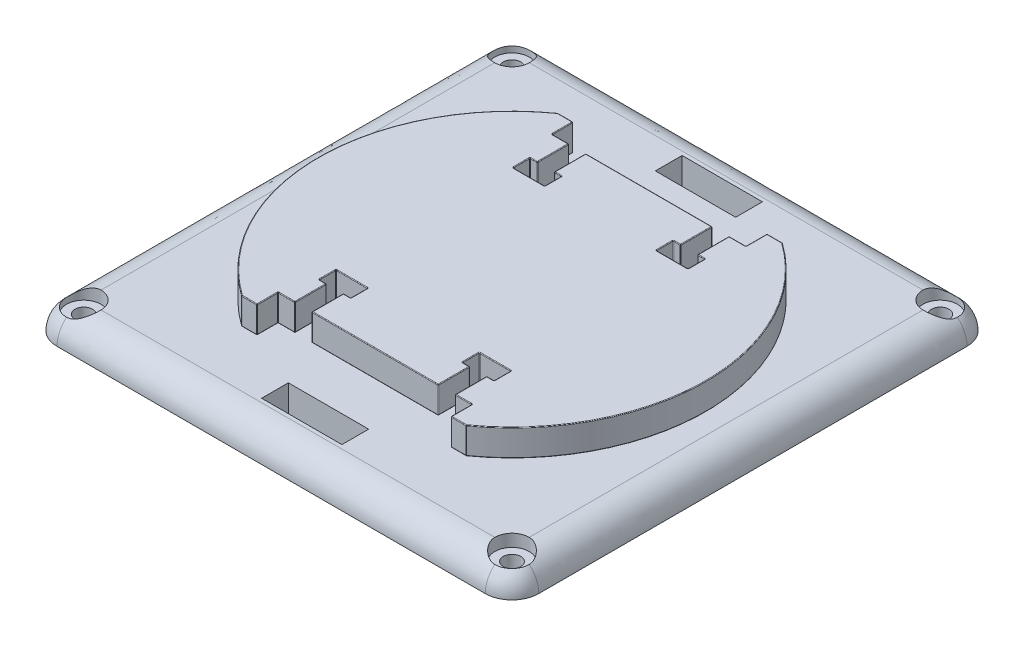
from build123d import *

# Parameters (mm, degrees)
BOSS_EXTRUDE1_DEPTH = 6.35
SKETCH2_W           = 4
SKETCH2_H           = 7.5
SKETCH2_W_2         = 7.5
SKETCH2_H_2         = 4
CUT_EXTRUDE1_DEPTH  = 60.687289267
FILLET1_R           = 0.15
SKETCH3_W           = 114.3
SKETCH3_H           = 114.3
BOSS_EXTRUDE2_DEPTH = 6.35
FILLET4_R           = 6.35
FILLET5_R           = 6.35
FILLET6_R           = 6.35
FILLET7_R           = 6.35
SKETCH4_R           = 4.0894
SKETCH4_R_2         = 2.0828
CUT_EXTRUDE3_DEPTH  = 2.921
SKETCH5_R           = 2.0828
CUT_EXTRUDE4_DEPTH  = 82.071373025
SKETCH6_W           = 19.05
SKETCH6_H           = 6.35
CUT_EXTRUDE5_DEPTH  = 82.071373025


with BuildPart() as part:
    # Sketch1 → Boss-Extrude1 (new body)
    with BuildSketch(Plane(origin=(0, 0, 0), x_dir=(1, 0, 0), z_dir=(0, 1, 0))):
        with BuildLine():
            Line((-26.64113361, 37.5), (-23, 37.5))
            Line((-23, 37.5), (-23, 32.5))
            Line((-23, 32.5), (23, 32.5))
            Line((23, 32.5), (23, 37.5))
            Line((23, 37.5), (26.64113361, 37.5))
            ThreePointArc((26.64113361, 37.5), (46, 0), (26.64113361, -37.5))
            Line((26.64113361, -37.5), (23, -37.5))
            Line((23, -37.5), (23, -32.5))
            Line((23, -32.5), (-23, -32.5))
            Line((-23, -32.5), (-23, -37.5))
            Line((-23, -37.5), (-26.64113361, -37.5))
            ThreePointArc((-26.64113361, -37.5), (-46, 0), (-26.64113361, 37.5))
        make_face()
    extrude(amount=BOSS_EXTRUDE1_DEPTH)

    # Sketch2 → Cut-Extrude1 (cut, through all)
    with BuildSketch(Plane(origin=(0, 6.35, 0), x_dir=(1, 0, 0), z_dir=(0, 1, 0))):
        with Locations((-17, 28.75)):
            Rectangle(SKETCH2_W, SKETCH2_H)
        with Locations((-17, 23)):
            Rectangle(SKETCH2_W_2, SKETCH2_H_2)
        with Locations((17, 23)):
            Rectangle(SKETCH2_W_2, SKETCH2_H_2)
        with Locations((17, 28.75)):
            Rectangle(SKETCH2_W, SKETCH2_H)
        with Locations((17, -28.75)):
            Rectangle(SKETCH2_W, SKETCH2_H)
        with Locations((17, -23)):
            Rectangle(SKETCH2_W_2, SKETCH2_H_2)
        with Locations((-17, -23)):
            Rectangle(SKETCH2_W_2, SKETCH2_H_2)
        with Locations((-17, -28.75)):
            Rectangle(SKETCH2_W, SKETCH2_H)
    extrude(amount=-CUT_EXTRUDE1_DEPTH, mode=Mode.SUBTRACT)

    # Fillet1
    fillet1_edges = [part.edges().sort_by_distance(p)[0] for p in [
        (15, 6.35, -28.75),
        (15, 3.175, -25),
        (15, 3.175, -32.5),
        (19, 0, -28.75),
        (19, 3.175, -32.5),
        (19.875, 0, -25),
        (13.25, 0, -23),
        (14.125, 0, -25),
        (15, 0, -28.75),
        (17, 6.35, -21),
        (20.75, 6.35, -23),
        (19, 6.35, -28.75),
        (17, 0, -21),
        (20.75, 3.175, -21),
        (13.25, 6.35, -23),
        (13.25, 3.175, -21),
        (20.75, 0, -23),
        (20.75, 3.175, -25),
        (19, 3.175, -25),
        (19.875, 6.35, -25),
        (13.25, 3.175, -25),
        (14.125, 6.35, -25),
        (-21, 0, 32.5),
        (-23, 0, 35),
        (46, 6.35, 0),
        (-24.820566805, 0, 37.5),
        (-46, 0, 0),
        (-24.820566805, 0, -37.5),
        (-23, 0, -35),
        (21, 0, -32.5),
        (23, 0, -35),
        (24.820566805, 0, -37.5),
        (46, 0, 0),
        (24.820566805, 0, 37.5),
        (23, 0, 35),
        (24.820566805, 6.35, -37.5),
        (23, 3.175, 32.5),
        (-23, 3.175, 32.5),
        (-23, 3.175, 37.5),
        (23, 6.35, -35),
        (-26.64113361, 3.175, 37.5),
        (-26.64113361, 3.175, -37.5),
        (-23, 3.175, -37.5),
        (-23, 3.175, -32.5),
        (23, 3.175, -32.5),
        (23, 3.175, -37.5),
        (26.64113361, 3.175, -37.5),
        (26.64113361, 3.175, 37.5),
        (23, 3.175, 37.5),
        (21, 6.35, -32.5),
        (-23, 6.35, -35),
        (-24.820566805, 6.35, -37.5),
        (0, 0, 32.5),
        (21, 0, 32.5),
        (-46, 6.35, 0),
        (0, 0, -32.5),
        (-21, 0, -32.5),
        (-24.820566805, 6.35, 37.5),
        (-23, 6.35, 35),
        (-21, 6.35, 32.5),
        (23, 6.35, 35),
        (0, 6.35, -32.5),
        (-21, 6.35, -32.5),
        (0, 6.35, 32.5),
        (21, 6.35, 32.5),
        (-19, 6.35, -28.75),
        (-19, 3.175, -25),
        (-19, 3.175, -32.5),
        (-15, 0, -28.75),
        (-15, 3.175, -32.5),
        (-17, 0, -21),
        (-20.75, 0, -23),
        (-19, 0, -28.75),
        (-19.875, 6.35, -25),
        (-13.25, 6.35, -23),
        (-14.125, 6.35, -25),
        (-15, 6.35, -28.75),
        (-17, 6.35, -21),
        (-13.25, 3.175, -21),
        (-20.75, 6.35, -23),
        (-20.75, 3.175, -21),
        (-13.25, 0, -23),
        (-13.25, 3.175, -25),
        (-14.125, 0, -25),
        (-15, 3.175, -25),
        (-19.875, 0, -25),
        (-20.75, 3.175, -25),
        (17, 6.35, 21),
        (13.25, 3.175, 21),
        (20.75, 6.35, 23),
        (20.75, 3.175, 21),
        (13.25, 0, 23),
        (13.25, 3.175, 25),
        (13.25, 6.35, 23),
        (14.125, 6.35, 25),
        (15, 6.35, 28.75),
        (19.875, 6.35, 25),
        (17, 0, 21),
        (20.75, 0, 23),
        (19, 0, 28.75),
        (14.125, 0, 25),
        (15, 3.175, 25),
        (19.875, 0, 25),
        (20.75, 3.175, 25),
        (19, 3.175, 32.5),
        (15, 0, 28.75),
        (15, 3.175, 32.5),
        (19, 6.35, 28.75),
        (19, 3.175, 25),
        (24.820566805, 6.35, 37.5),
        (-15, 6.35, 28.75),
        (-15, 3.175, 25),
        (-15, 3.175, 32.5),
        (-19, 0, 28.75),
        (-19, 3.175, 32.5),
        (-19.875, 0, 25),
        (-13.25, 0, 23),
        (-14.125, 0, 25),
        (-15, 0, 28.75),
        (-17, 6.35, 21),
        (-20.75, 6.35, 23),
        (-19, 6.35, 28.75),
        (-17, 0, 21),
        (-20.75, 3.175, 21),
        (-13.25, 6.35, 23),
        (-13.25, 3.175, 21),
        (-20.75, 0, 23),
        (-20.75, 3.175, 25),
        (-19, 3.175, 25),
        (-19.875, 6.35, 25),
        (-13.25, 3.175, 25),
        (-14.125, 6.35, 25),
    ]]
    fillet(fillet1_edges, radius=FILLET1_R)

    # Sketch3 → Boss-Extrude2 (add)
    with BuildSketch(Plane.XZ):
        Rectangle(SKETCH3_W, SKETCH3_H)
    extrude(amount=BOSS_EXTRUDE2_DEPTH)

    # Fillet4
    fillet4_edges = [part.edges().sort_by_distance(p)[0] for p in [
        (57.15, 0, 0),
    ]]
    fillet(fillet4_edges, radius=FILLET4_R - 0.0001)  # a hair under: the kernel refuses the full size

    # Fillet5
    fillet5_edges = [part.edges().sort_by_distance(p)[0] for p in [
        (55.29015735, -1.85984265, -57.15),
        (-3.17495, 0, -57.15),
    ]]
    fillet(fillet5_edges, radius=FILLET5_R - 0.0001)  # a hair under: the kernel refuses the full size

    # Fillet6
    fillet6_edges = [part.edges().sort_by_distance(p)[0] for p in [
        (-57.15, -1.85984265, -55.29015735),
        (-57.15, 0, 3.17495),
    ]]
    fillet(fillet6_edges, radius=FILLET6_R - 0.0001)  # a hair under: the kernel refuses the full size

    # Fillet7
    fillet7_edges = [part.edges().sort_by_distance(p)[0] for p in [
        (-55.29015735, -1.85984265, 57.15),
        (55.29015735, -1.85984265, 57.15),
        (0, 0, 57.15),
    ]]
    fillet(fillet7_edges, radius=FILLET7_R - 0.0001)  # a hair under: the kernel refuses the full size

    # Sketch4 → Cut-Extrude3 (cut)
    # profile 1 of 4: a face of its own
    with BuildSketch(Plane(origin=(0, 0, 0), x_dir=(-1, 0, 0), z_dir=(0, -1, 0))):
        with Locations(Location((-50.8, 50.8, 0), (0, 0, 90))):
            Circle(SKETCH4_R)
        with Locations(Location((-50.8, 50.8, 0), (0, 0, 90))):
            Circle(SKETCH4_R_2, mode=Mode.SUBTRACT)
    # profile 2 of 4: a face of its own
    with BuildSketch(Plane(origin=(0, 0, 0), x_dir=(-1, 0, 0), z_dir=(0, -1, 0))):
        with Locations(Location((50.8, 50.8, 0), (0, 0, 270))):
            Circle(SKETCH4_R)
        with Locations(Location((50.8, 50.8, 0), (0, 0, 270))):
            Circle(SKETCH4_R_2, mode=Mode.SUBTRACT)
    # profile 3 of 4: a face of its own
    with BuildSketch(Plane(origin=(0, 0, 0), x_dir=(-1, 0, 0), z_dir=(0, -1, 0))):
        with Locations(Location((-50.8, -50.8, 0), (0, 0, 270))):
            Circle(SKETCH4_R)
        with Locations(Location((-50.8, -50.8, 0), (0, 0, 270))):
            Circle(SKETCH4_R_2, mode=Mode.SUBTRACT)
    # profile 4 of 4: a face of its own
    with BuildSketch(Plane(origin=(0, 0, 0), x_dir=(-1, 0, 0), z_dir=(0, -1, 0))):
        with Locations(Location((50.8, -50.8, 0), (0, 0, 90))):
            Circle(SKETCH4_R)
        with Locations(Location((50.8, -50.8, 0), (0, 0, 90))):
            Circle(SKETCH4_R_2, mode=Mode.SUBTRACT)
    extrude(amount=CUT_EXTRUDE3_DEPTH, mode=Mode.SUBTRACT)

    # Sketch5 → Cut-Extrude4 (cut, through all)
    with BuildSketch(Plane(origin=(0, 0, 0), x_dir=(1, 0, 0), z_dir=(0, 1, 0))):
        with Locations(Location((50.8, 50.8, 0), (0, 0, 90))):
            Circle(SKETCH5_R)
        with Locations(Location((-50.8, 50.8, 0), (0, 0, 270))):
            Circle(SKETCH5_R)
        with Locations(Location((50.8, -50.8, 0), (0, 0, 270))):
            Circle(SKETCH5_R)
        with Locations(Location((-50.8, -50.8, 0), (0, 0, 90))):
            Circle(SKETCH5_R)
    extrude(amount=-CUT_EXTRUDE4_DEPTH, mode=Mode.SUBTRACT)

    # Sketch6 → Cut-Extrude5 (cut, through all)
    with BuildSketch(Plane(origin=(0, 0, 0), x_dir=(1, 0, 0), z_dir=(0, 1, 0))):
        with Locations((0, 46.7106)):
            Rectangle(SKETCH6_W, SKETCH6_H)
        with Locations((0, -46.7106)):
            Rectangle(SKETCH6_W, SKETCH6_H)
    extrude(amount=-CUT_EXTRUDE5_DEPTH, mode=Mode.SUBTRACT)


solid = part.part
